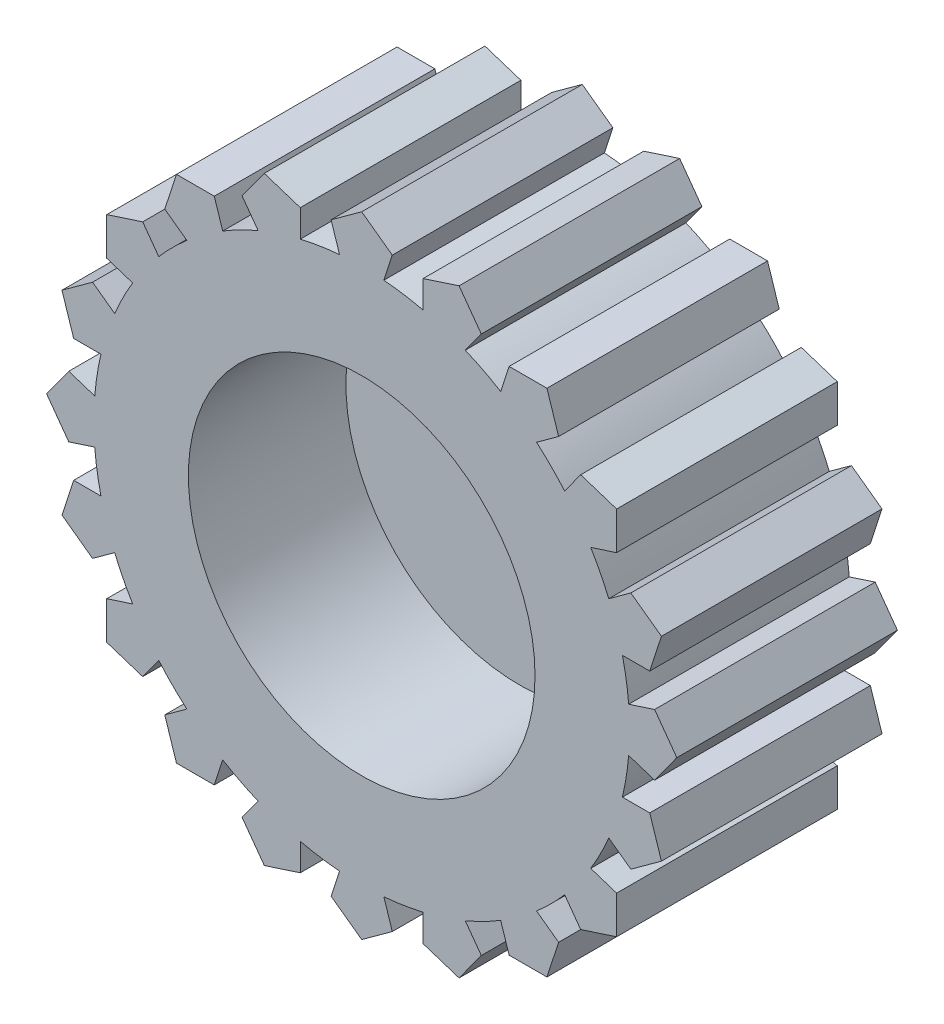
from build123d import *

# Parameters (mm, degrees)
BOSS_EXTRUDE1_OUTLINE_R = 5.5
BOSS_EXTRUDE1_DEPTH     = 7
SKETCH1_3_R             = 5.5
BOSS_EXTRUDE2_DEPTH     = 2


# Read off the part's stored shape, not the designer's step: Boss-Extrude1
with BuildPart() as part:
    # Boss-Extrude1 outline → Boss-Extrude1 (new body)
    with BuildSketch(Plane.XY):
        with BuildLine():
            Line((-0.970820393, 9.294657697), (-0.703154307, 8.470866191))
            ThreePointArc((-0.703154307, 8.470866191), (-1.329692953, 8.395350895), (-1.948902124, 8.27355912))
            Line((-1.948902124, 8.27355912), (-1.948902124, 9.13974477))
            Line((-1.948902124, 9.13974477), (-3.090169944, 9.510565163))
            Line((-3.090169944, 9.510565163), (-3.795512247, 8.53974477))
            Line((-3.795512247, 8.53974477), (-3.286381096, 7.838985859))
            ThreePointArc((-3.286381096, 7.838985859), (-3.858919248, 7.573555456), (-4.410186437, 7.266378437))
            Line((-4.410186437, 7.266378437), (-4.677852523, 8.090169944))
            Line((-4.677852523, 8.090169944), (-5.877852523, 8.090169944))
            Line((-5.877852523, 8.090169944), (-6.248672916, 6.948902124))
            Line((-6.248672916, 6.948902124), (-5.547914005, 6.439770973))
            ThreePointArc((-5.547914005, 6.439770973), (-6.01040764, 6.01040764), (-6.439770973, 5.547914005))
            Line((-6.439770973, 5.547914005), (-6.948902124, 6.248672916))
            Line((-6.948902124, 6.248672916), (-8.090169944, 5.877852523))
            Line((-8.090169944, 5.877852523), (-8.090169944, 4.677852523))
            Line((-8.090169944, 4.677852523), (-7.266378437, 4.410186437))
            ThreePointArc((-7.266378437, 4.410186437), (-7.573555456, 3.858919248), (-7.838985859, 3.286381096))
            Line((-7.838985859, 3.286381096), (-8.53974477, 3.795512246))
            Line((-8.53974477, 3.795512246), (-9.510565163, 3.090169944))
            Line((-9.510565163, 3.090169944), (-9.13974477, 1.948902124))
            Line((-9.13974477, 1.948902124), (-8.27355912, 1.948902124))
            ThreePointArc((-8.27355912, 1.948902124), (-8.395350895, 1.329692953), (-8.470866191, 0.703154307))
            Line((-8.470866191, 0.703154307), (-9.294657697, 0.970820393))
            Line((-9.294657697, 0.970820393), (-10, 0))
            Line((-10, 0), (-9.294657697, -0.970820393))
            Line((-9.294657697, -0.970820393), (-8.470866191, -0.703154307))
            ThreePointArc((-8.470866191, -0.703154307), (-8.395350895, -1.329692953), (-8.27355912, -1.948902124))
            Line((-8.27355912, -1.948902124), (-9.13974477, -1.948902124))
            Line((-9.13974477, -1.948902124), (-9.510565163, -3.090169944))
            Line((-9.510565163, -3.090169944), (-8.53974477, -3.795512247))
            Line((-8.53974477, -3.795512247), (-7.838985859, -3.286381096))
            ThreePointArc((-7.838985859, -3.286381096), (-7.573555456, -3.858919248), (-7.266378437, -4.410186437))
            Line((-7.266378437, -4.410186437), (-8.090169944, -4.677852523))
            Line((-8.090169944, -4.677852523), (-8.090169944, -5.877852523))
            Line((-8.090169944, -5.877852523), (-6.948902124, -6.248672916))
            Line((-6.948902124, -6.248672916), (-6.439770973, -5.547914005))
            ThreePointArc((-6.439770973, -5.547914005), (-6.01040764, -6.01040764), (-5.547914005, -6.439770973))
            Line((-5.547914005, -6.439770973), (-6.248672916, -6.948902124))
            Line((-6.248672916, -6.948902124), (-5.877852523, -8.090169944))
            Line((-5.877852523, -8.090169944), (-4.677852523, -8.090169944))
            Line((-4.677852523, -8.090169944), (-4.410186437, -7.266378437))
            ThreePointArc((-4.410186437, -7.266378437), (-3.858919248, -7.573555456), (-3.286381096, -7.838985859))
            Line((-3.286381096, -7.838985859), (-3.795512246, -8.53974477))
            Line((-3.795512246, -8.53974477), (-3.090169944, -9.510565163))
            Line((-3.090169944, -9.510565163), (-1.948902124, -9.13974477))
            Line((-1.948902124, -9.13974477), (-1.948902124, -8.27355912))
            ThreePointArc((-1.948902124, -8.27355912), (-1.329692953, -8.395350895), (-0.703154307, -8.470866191))
            Line((-0.703154307, -8.470866191), (-0.970820393, -9.294657697))
            Line((-0.970820393, -9.294657697), (0, -10))
            Line((0, -10), (0.970820393, -9.294657697))
            Line((0.970820393, -9.294657697), (0.703154307, -8.470866191))
            ThreePointArc((0.703154307, -8.470866191), (1.329692953, -8.395350895), (1.948902124, -8.27355912))
            Line((1.948902124, -8.27355912), (1.948902124, -9.13974477))
            Line((1.948902124, -9.13974477), (3.090169944, -9.510565163))
            Line((3.090169944, -9.510565163), (3.795512247, -8.53974477))
            Line((3.795512247, -8.53974477), (3.286381096, -7.838985859))
            ThreePointArc((3.286381096, -7.838985859), (3.858919248, -7.573555456), (4.410186437, -7.266378437))
            Line((4.410186437, -7.266378437), (4.677852523, -8.090169944))
            Line((4.677852523, -8.090169944), (5.877852523, -8.090169944))
            Line((5.877852523, -8.090169944), (6.248672916, -6.948902124))
            Line((6.248672916, -6.948902124), (5.547914005, -6.439770973))
            ThreePointArc((5.547914005, -6.439770973), (6.01040764, -6.01040764), (6.439770973, -5.547914005))
            Line((6.439770973, -5.547914005), (6.948902124, -6.248672916))
            Line((6.948902124, -6.248672916), (8.090169944, -5.877852523))
            Line((8.090169944, -5.877852523), (8.090169944, -4.677852523))
            Line((8.090169944, -4.677852523), (7.266378437, -4.410186437))
            ThreePointArc((7.266378437, -4.410186437), (7.573555456, -3.858919248), (7.838985859, -3.286381096))
            Line((7.838985859, -3.286381096), (8.53974477, -3.795512246))
            Line((8.53974477, -3.795512246), (9.510565163, -3.090169944))
            Line((9.510565163, -3.090169944), (9.13974477, -1.948902124))
            Line((9.13974477, -1.948902124), (8.27355912, -1.948902124))
            ThreePointArc((8.27355912, -1.948902124), (8.395350895, -1.329692953), (8.470866191, -0.703154307))
            Line((8.470866191, -0.703154307), (9.294657697, -0.970820393))
            Line((9.294657697, -0.970820393), (10, 0))
            Line((10, 0), (9.294657697, 0.970820393))
            Line((9.294657697, 0.970820393), (8.470866191, 0.703154307))
            ThreePointArc((8.470866191, 0.703154307), (8.395350895, 1.329692953), (8.27355912, 1.948902124))
            Line((8.27355912, 1.948902124), (9.13974477, 1.948902124))
            Line((9.13974477, 1.948902124), (9.510565163, 3.090169944))
            Line((9.510565163, 3.090169944), (8.53974477, 3.795512247))
            Line((8.53974477, 3.795512247), (7.838985859, 3.286381096))
            ThreePointArc((7.838985859, 3.286381096), (7.573555456, 3.858919248), (7.266378437, 4.410186437))
            Line((7.266378437, 4.410186437), (8.090169944, 4.677852523))
            Line((8.090169944, 4.677852523), (8.090169944, 5.877852523))
            Line((8.090169944, 5.877852523), (6.948902124, 6.248672916))
            Line((6.948902124, 6.248672916), (6.439770973, 5.547914005))
            ThreePointArc((6.439770973, 5.547914005), (6.01040764, 6.01040764), (5.547914005, 6.439770973))
            Line((5.547914005, 6.439770973), (6.248672916, 6.948902124))
            Line((6.248672916, 6.948902124), (5.877852523, 8.090169944))
            Line((5.877852523, 8.090169944), (4.677852523, 8.090169944))
            Line((4.677852523, 8.090169944), (4.410186437, 7.266378437))
            ThreePointArc((4.410186437, 7.266378437), (3.858919248, 7.573555456), (3.286381096, 7.838985859))
            Line((3.286381096, 7.838985859), (3.795512247, 8.53974477))
            Line((3.795512247, 8.53974477), (3.090169944, 9.510565163))
            Line((3.090169944, 9.510565163), (1.948902124, 9.13974477))
            Line((1.948902124, 9.13974477), (1.948902124, 8.27355912))
            ThreePointArc((1.948902124, 8.27355912), (1.329692953, 8.395350895), (0.703154307, 8.470866191))
            Line((0.703154307, 8.470866191), (0.970820393, 9.294657697))
            Line((0.970820393, 9.294657697), (0, 10))
            Line((0, 10), (-0.970820393, 9.294657697))
        make_face()
        Circle(BOSS_EXTRUDE1_OUTLINE_R, mode=Mode.SUBTRACT)
    extrude(amount=BOSS_EXTRUDE1_DEPTH)

    # Sketch1<3> → Boss-Extrude2 (add)
    with BuildSketch(Plane.XY):
        Circle(SKETCH1_3_R)
    extrude(amount=BOSS_EXTRUDE2_DEPTH)


solid = part.part
